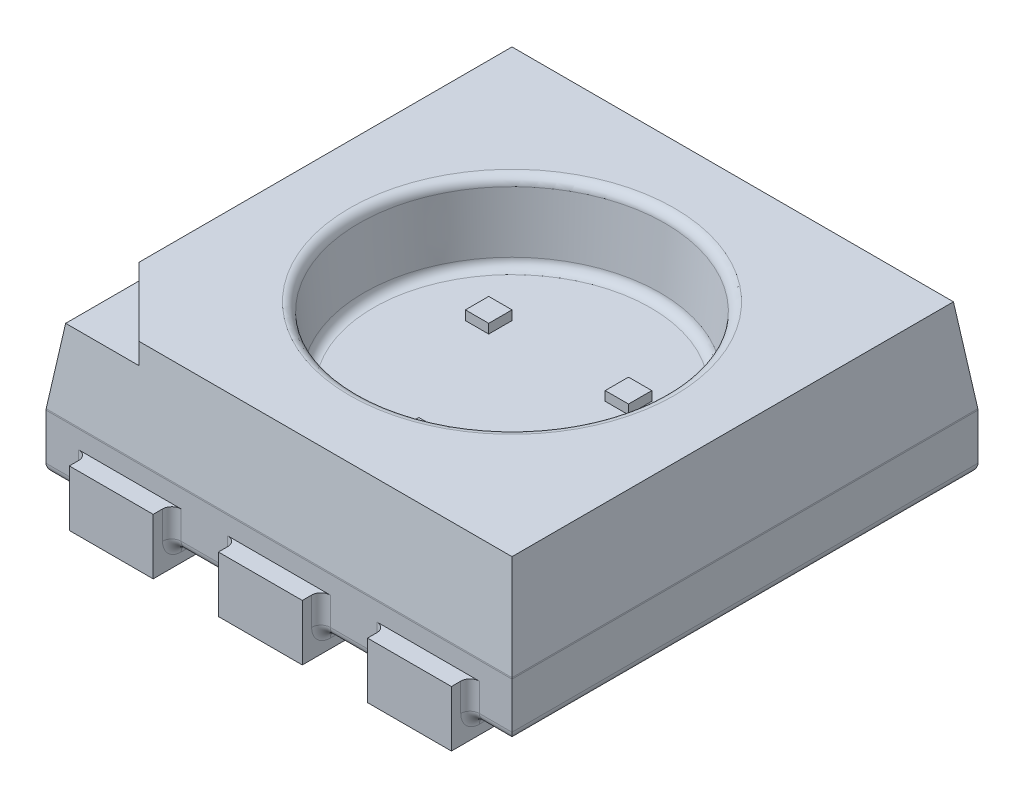
from build123d import *
from OCP.BRepFilletAPI import BRepFilletAPI_MakeChamfer

# Parameters (mm, degrees)
SKETCH1_W                = 5
SKETCH1_H                = 5
BOSS_EXTRUDE1_DEPTH      = 0.8
BOSS_EXTRUDE2_DEPTH      = 0.2
BOSS_EXTRUDE2_DEPTH_BACK = 0.4
SKETCH2_W                = 0.9
SKETCH2_H                = 1
CHAMFER1_SIZE            = 1
CHAMFER1_SIZE2           = 0.131652498
CUT_EXTRUDE1_DEPTH       = 0.2
SKETCH4_R                = 1.65
CUT_EXTRUDE2_DEPTH       = 0.8
CUT_EXTRUDE2_DRAFT       = -5
FILLET1_R                = 0.1
SKETCH5_W                = 0.25
SKETCH5_H                = 0.25
BOSS_EXTRUDE4_DEPTH      = 0.1
BOSS_EXTRUDE4_2_DEPTH    = 0.1
BOSS_EXTRUDE4_3_DEPTH    = 0.1


with BuildPart() as part:
    # Sketch1 → Boss-Extrude1 (new, symmetric)
    with BuildSketch(Plane(origin=(0, 0, 0), x_dir=(1, 0, 0), z_dir=(0, 1, 0))):
        Rectangle(SKETCH1_W, SKETCH1_H)
    extrude(amount=BOSS_EXTRUDE1_DEPTH, both=True)

    # Sketch2 → Boss-Extrude2 (add, two sides: drawn at the far end of the back side and taken through both)
    with BuildSketch(Plane.XZ.offset(0.8).offset(-BOSS_EXTRUDE2_DEPTH_BACK)):
        with Locations((-1.6, 2.2)):
            Rectangle(SKETCH2_W, SKETCH2_H)
        with Locations((1.6, 2.2)):
            Rectangle(SKETCH2_W, SKETCH2_H)
        with Locations((0, 2.2)):
            Rectangle(SKETCH2_W, SKETCH2_H)
        with Locations((1.6, -2.2)):
            Rectangle(SKETCH2_W, SKETCH2_H)
        with Locations((0, -2.2)):
            Rectangle(SKETCH2_W, SKETCH2_H)
        with Locations((-1.6, -2.2)):
            Rectangle(SKETCH2_W, SKETCH2_H)
    extrude(amount=BOSS_EXTRUDE2_DEPTH + BOSS_EXTRUDE2_DEPTH_BACK)

    # Chamfer1: one chamfer whose edges measure the first distance from different faces: ONE call of the kernel's chamfer builder (chamfer() names one face for all edges)
    chamfer1_edges_1 = [part.edges().sort_by_distance(p)[0] for p in [
        (0, 0.8, 2.5),
    ]]
    chamfer1_side_1 = [part.faces().sort_by_distance(p)[0] for p in [
        (0, 0.093641618, 2.5),
    ]]
    chamfer1_edges_2 = [part.edges().sort_by_distance(p)[0] for p in [
        (-2.5, 0.8, 0),
    ]]
    chamfer1_side_2 = [part.faces().sort_by_distance(p)[0] for p in [
        (-2.5, 0, 0),
    ]]
    chamfer1_edges_3 = [part.edges().sort_by_distance(p)[0] for p in [
        (0, 0.8, -2.5),
    ]]
    chamfer1_side_3 = [part.faces().sort_by_distance(p)[0] for p in [
        (0, 0.093641618, -2.5),
    ]]
    chamfer1_edges_4 = [part.edges().sort_by_distance(p)[0] for p in [
        (2.5, 0.8, 0),
    ]]
    chamfer1_side_4 = [part.faces().sort_by_distance(p)[0] for p in [
        (2.5, 0, 0),
    ]]
    chamfer1 = BRepFilletAPI_MakeChamfer(part.part.solid().wrapped)
    for e in chamfer1_edges_1:
        chamfer1.Add(CHAMFER1_SIZE, CHAMFER1_SIZE2, e.wrapped, chamfer1_side_1[0].wrapped)  # the first distance lies on this face
    for e in chamfer1_edges_2:
        chamfer1.Add(CHAMFER1_SIZE, CHAMFER1_SIZE2, e.wrapped, chamfer1_side_2[0].wrapped)  # the first distance lies on this face
    for e in chamfer1_edges_3:
        chamfer1.Add(CHAMFER1_SIZE, CHAMFER1_SIZE2, e.wrapped, chamfer1_side_3[0].wrapped)  # the first distance lies on this face
    for e in chamfer1_edges_4:
        chamfer1.Add(CHAMFER1_SIZE, CHAMFER1_SIZE2, e.wrapped, chamfer1_side_4[0].wrapped)  # the first distance lies on this face
    add(Compound.cast(chamfer1.Shape()), mode=Mode.REPLACE)

    # Sketch3 → Cut-Extrude1 (cut)
    with BuildSketch(Plane(origin=(0, 0.8, 0), x_dir=(1, 0, 0), z_dir=(0, 1, 0))):
        Polygon((-2.5, -1.5), (-1.5, -2.5), (-2.5, -2.5), align=None)
    extrude(amount=-CUT_EXTRUDE1_DEPTH, mode=Mode.SUBTRACT)


with BuildPart() as cut_extrude2_tool:
    # Sketch4 → Cut-Extrude2 (with draft: the straight prism first)
    with BuildSketch(Plane(origin=(0, 0.8, 0), x_dir=(1, 0, 0), z_dir=(0, 1, 0))):
        Circle(SKETCH4_R)
    extrude(amount=-CUT_EXTRUDE2_DEPTH)
    # Cut-Extrude2: the draft: its side faces are tilted about the plane it starts from
    cut_extrude2_sides = [cut_extrude2_tool.faces().sort_by_distance(p)[0] for p in [
        (-1.65, 0.4, 0),
    ]]
    draft(cut_extrude2_sides, Plane(origin=(0, 0.8, 0), x_dir=(1, 0, 0), z_dir=(0, 1, 0)), CUT_EXTRUDE2_DRAFT)


with BuildPart() as part_1:
    add(part.part)

    # Cut-Extrude2: cut by cut_extrude2_tool
    add(cut_extrude2_tool.part, mode=Mode.SUBTRACT)

    # Fillet1
    fillet1_edges = [part_1.edges().sort_by_distance(p)[0] for p in [
        (-2.05, -0.6, 2.5),
        (-1.15, -0.6, 2.5),
        (-0.45, -0.6, 2.5),
        (0.45, -0.6, 2.5),
        (1.15, -0.6, 2.5),
        (2.05, -0.6, 2.5),
        (2.05, -0.6, -2.5),
        (1.15, -0.6, -2.5),
        (0.45, -0.6, -2.5),
        (-0.45, -0.6, -2.5),
        (-1.15, -0.6, -2.5),
        (-2.05, -0.6, -2.5),
        (-2.5, -0.8, 0),
        (-2.275, -0.8, 2.5),
        (-2.05, -0.8, 2.1),
        (-1.6, -0.8, 1.7),
        (-1.15, -0.8, 2.1),
        (-0.8, -0.8, 2.5),
        (-0.45, -0.8, 2.1),
        (0, -0.8, 1.7),
        (0.45, -0.8, 2.1),
        (0.8, -0.8, 2.5),
        (1.15, -0.8, 2.1),
        (1.6, -0.8, 1.7),
        (2.05, -0.8, 2.1),
        (2.275, -0.8, 2.5),
        (2.5, -0.8, 0),
        (2.275, -0.8, -2.5),
        (2.05, -0.8, -2.1),
        (1.6, -0.8, -1.7),
        (1.15, -0.8, -2.1),
        (0.8, -0.8, -2.5),
        (0.45, -0.8, -2.1),
        (0, -0.8, -1.7),
        (-0.45, -0.8, -2.1),
        (-0.8, -0.8, -2.5),
        (-1.15, -0.8, -2.1),
        (-1.6, -0.8, -1.7),
        (-2.05, -0.8, -2.1),
        (-2.275, -0.8, -2.5),
        (0, -0.2, -2.5),
        (2.5, -0.2, 0),
        (0, -0.2, 2.5),
        (-2.5, -0.2, 0),
        (-1.65, 0.8, 0),
        (-1.580009069, 0, 0),
    ]]
    fillet(fillet1_edges, radius=FILLET1_R)


with BuildPart() as body_2:
    # Sketch5 → Boss-Extrude4 (new body)
    with BuildSketch(Plane(origin=(0, 0, 0), x_dir=(1, 0, 0), z_dir=(0, 1, 0))):
        with Locations((-0.75, 0.5)):
            Rectangle(SKETCH5_W, SKETCH5_H)
    extrude(amount=BOSS_EXTRUDE4_DEPTH)


with BuildPart() as body_3:
    # Sketch5 → Boss-Extrude4 2 (new body)
    with BuildSketch(Plane(origin=(0, 0, 0), x_dir=(1, 0, 0), z_dir=(0, 1, 0))):
        with Locations((0, -1)):
            Rectangle(SKETCH5_W, SKETCH5_H)
    extrude(amount=BOSS_EXTRUDE4_2_DEPTH)


with BuildPart() as body_4:
    # Sketch5 → Boss-Extrude4 3 (new body)
    with BuildSketch(Plane(origin=(0, 0, 0), x_dir=(1, 0, 0), z_dir=(0, 1, 0))):
        with Locations((0.75, 0.5)):
            Rectangle(SKETCH5_W, SKETCH5_H)
    extrude(amount=BOSS_EXTRUDE4_3_DEPTH)


solid = Compound([part_1.part, body_2.part, body_3.part, body_4.part])
